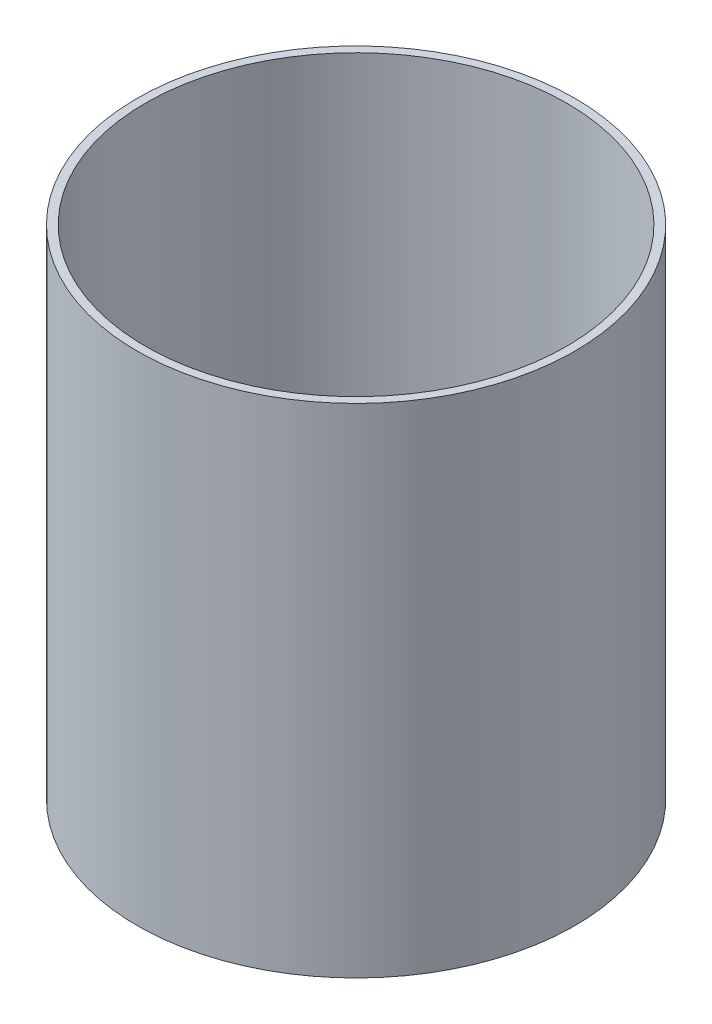
from build123d import *

# Parameters (mm, degrees)
SKETCH1_R           = 39.6
SKETCH1_R_2         = 38.1
BOSS_EXTRUDE1_DEPTH = 90


with BuildPart() as part:
    # Sketch1 → Boss-Extrude1 (new body)
    with BuildSketch(Plane(origin=(0, 0, 0), x_dir=(1, 0, 0), z_dir=(0, 1, 0))):
        Circle(SKETCH1_R)
        Circle(SKETCH1_R_2, mode=Mode.SUBTRACT)
    extrude(amount=BOSS_EXTRUDE1_DEPTH)


solid = part.part
